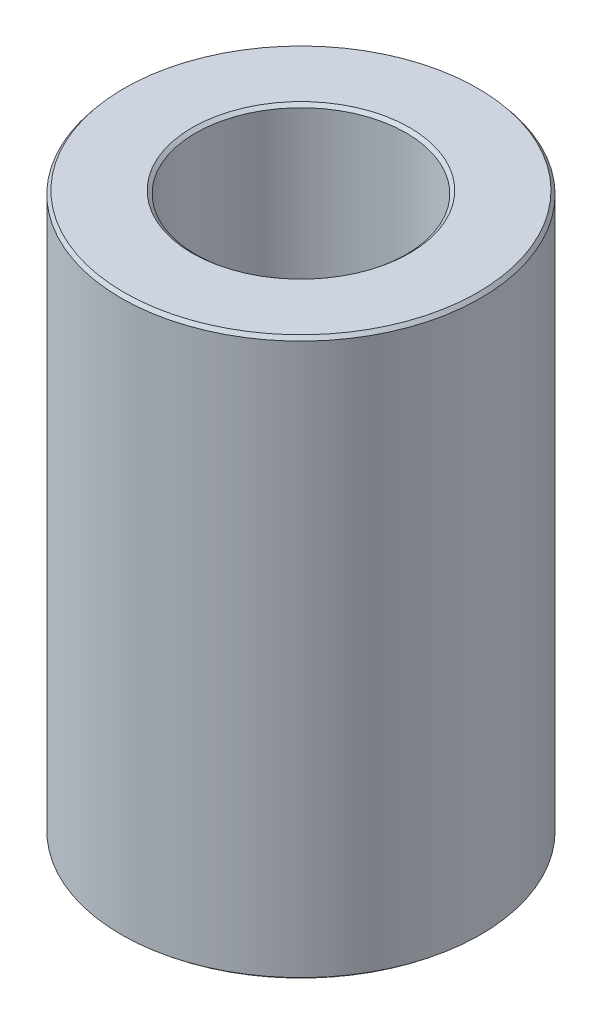
from build123d import *
from OCP.BRepFilletAPI import BRepFilletAPI_MakeChamfer

# Parameters (mm, degrees)
SKETCH1_R           = 57.5
BOSS_EXTRUDE1_DEPTH = 178.411777979
SKETCH2_R           = 33.686300456
CUT_EXTRUDE1_DEPTH  = 197.069534915
CHAMFER1_SIZE       = 1.122419629
CHAMFER1_SIZE2      = 0.92126715


with BuildPart() as part:
    # Sketch1 → Boss-Extrude1 (new body)
    with BuildSketch(Plane(origin=(0, 0, 0), x_dir=(1, 0, 0), z_dir=(0, 1, 0))):
        Circle(SKETCH1_R)
    extrude(amount=BOSS_EXTRUDE1_DEPTH)

    # Sketch2 → Cut-Extrude1 (cut, through all)
    with BuildSketch(Plane(origin=(0, 0, 0), x_dir=(1, 0, 0), z_dir=(0, 1, 0))):
        Circle(SKETCH2_R)
    extrude(amount=CUT_EXTRUDE1_DEPTH, mode=Mode.SUBTRACT)

    # Chamfer1: one chamfer whose edges measure the first distance from different faces: ONE call of the kernel's chamfer builder (chamfer() names one face for all edges)
    chamfer1_edges_1 = [part.edges().sort_by_distance(p)[0] for p in [
        (-33.686300456, 178.411777979, 0),
    ]]
    chamfer1_side_1 = [part.faces().sort_by_distance(p)[0] for p in [
        (-55.873654403, 178.411777979, 0),
    ]]
    chamfer1_edges_2 = [part.edges().sort_by_distance(p)[0] for p in [
        (-33.686300456, 0, 0),
    ]]
    chamfer1_side_2 = [part.faces().sort_by_distance(p)[0] for p in [
        (-33.686300456, 89.20588899, 0),
    ]]
    chamfer1_edges_3 = [part.edges().sort_by_distance(p)[0] for p in [
        (-57.5, 0, 0),
    ]]
    chamfer1_side_3 = [part.faces().sort_by_distance(p)[0] for p in [
        (-55.873654403, 0, 0),
    ]]
    chamfer1_edges_4 = [part.edges().sort_by_distance(p)[0] for p in [
        (-57.5, 178.411777979, 0),
    ]]
    chamfer1_side_4 = [part.faces().sort_by_distance(p)[0] for p in [
        (-57.5, 89.20588899, 0),
    ]]
    chamfer1 = BRepFilletAPI_MakeChamfer(part.part.solid().wrapped)
    for e in chamfer1_edges_1:
        chamfer1.Add(CHAMFER1_SIZE, CHAMFER1_SIZE2, e.wrapped, chamfer1_side_1[0].wrapped)  # the first distance lies on this face
    for e in chamfer1_edges_2:
        chamfer1.Add(CHAMFER1_SIZE, CHAMFER1_SIZE2, e.wrapped, chamfer1_side_2[0].wrapped)  # the first distance lies on this face
    for e in chamfer1_edges_3:
        chamfer1.Add(CHAMFER1_SIZE, CHAMFER1_SIZE2, e.wrapped, chamfer1_side_3[0].wrapped)  # the first distance lies on this face
    for e in chamfer1_edges_4:
        chamfer1.Add(CHAMFER1_SIZE, CHAMFER1_SIZE2, e.wrapped, chamfer1_side_4[0].wrapped)  # the first distance lies on this face
    add(Compound.cast(chamfer1.Shape()), mode=Mode.REPLACE)


solid = part.part
